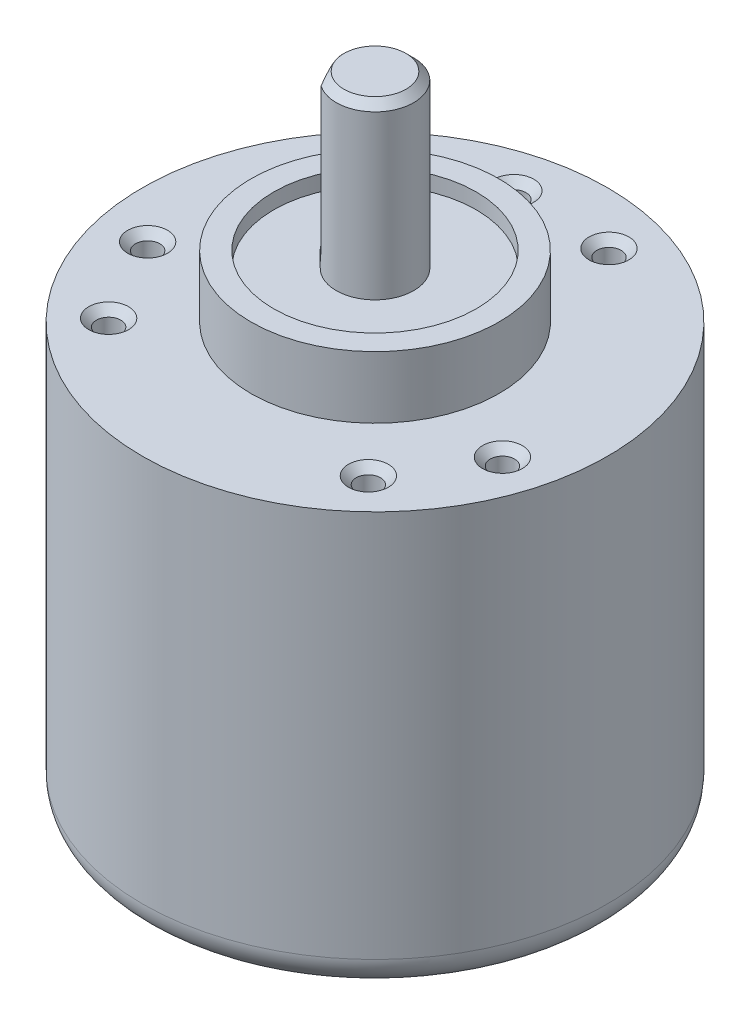
from build123d import *

# Parameters (mm, degrees)
SKETCH1_R           = 19.05
BOSS_EXTRUDE1_DEPTH = 34.29
SKETCH3_R           = 10.16
BOSS_EXTRUDE3_DEPTH = 5.08
BOSS_EXTRUDE4_DEPTH = 12.7
FILLET1_R           = 2.54
CHAMFER1_SIZE       = 0.635
SKETCH5_R           = 0.99695
CUT_EXTRUDE1_DEPTH  = 12.7
CHAMFER2_SIZE       = 0.635
CUT_EXTRUDE2_START  = -1.27
SKETCH6_R           = 8.296715315
SKETCH6_R_2         = 3.175
CUT_EXTRUDE2_DEPTH  = 1.27


with BuildPart() as part:
    # Sketch1 → Boss-Extrude1 (new body)
    with BuildSketch(Plane(origin=(0, 0, 0), x_dir=(1, 0, 0), z_dir=(0, 1, 0))):
        with Locations(Location((0, 0, 0), (0, 0, 270))):
            Circle(SKETCH1_R)
    extrude(amount=BOSS_EXTRUDE1_DEPTH)

    # Sketch3 → Boss-Extrude3 (add)
    with BuildSketch(Plane(origin=(0, 34.29, 0), x_dir=(1, 0, 0), z_dir=(0, 1, 0))):
        with Locations(Location((0, 0, 0), (0, 0, 270))):
            Circle(SKETCH3_R)
    extrude(amount=BOSS_EXTRUDE3_DEPTH)

    # Sketch4 → Boss-Extrude4 (add)
    with BuildSketch(Plane(origin=(0, 39.37, 0), x_dir=(1, 0, 0), z_dir=(0, 1, 0))):
        with BuildLine():
            Line((-3.01459652, 0.996409965), (-1.800640593, -2.615017869))
            ThreePointArc((-1.800640593, -2.615017869), (3.009523196, 1.01162994), (-3.01459652, 0.996409965))
        make_face()
    extrude(amount=BOSS_EXTRUDE4_DEPTH)

    # Fillet1
    fillet1_edges = [part.edges().sort_by_distance(p)[0] for p in [
        (0, 0, -19.05),
    ]]
    fillet(fillet1_edges, radius=FILLET1_R)

    # Chamfer1
    chamfer1_edges = [part.edges().sort_by_distance(p)[0] for p in [
        (3.009523196, 52.07, -1.01162994),
    ]]
    chamfer(chamfer1_edges, length=CHAMFER1_SIZE - 0.0001)  # a hair under: the kernel refuses the full size

    # Sketch5 → Cut-Extrude1 (cut)
    with BuildSketch(Plane(origin=(0, 34.29, 0), x_dir=(1, 0, 0), z_dir=(0, 1, 0))):
        with Locations(Location((-11.178825066, -10.636456195, 0), (0, 0, 270))):
            Circle(SKETCH5_R)
        with Locations(Location((-14.999374589, -3.622028738, 0), (0, 0, 270))):
            Circle(SKETCH5_R)
        with Locations(Location((-3.622028738, 14.999374589, 0), (0, 0, 270))):
            Circle(SKETCH5_R)
        with Locations(Location((4.362918394, 14.800853804, 0), (0, 0, 270))):
            Circle(SKETCH5_R)
        with Locations(Location((14.800853804, -4.362918394, 0), (0, 0, 270))):
            Circle(SKETCH5_R)
        with Locations(Location((10.636456195, -11.178825066, 0), (0, 0, 270))):
            Circle(SKETCH5_R)
    extrude(amount=-CUT_EXTRUDE1_DEPTH, mode=Mode.SUBTRACT)

    # Chamfer2
    chamfer2_edges = [part.edges().sort_by_distance(p)[0] for p in [
        (10.636456195, 34.29, 10.181875066),
        (14.800853804, 34.29, 3.365968394),
        (4.362918394, 34.29, -15.797803804),
        (-3.622028738, 34.29, -15.996324589),
        (-14.999374589, 34.29, 2.625078738),
        (-11.178825066, 34.29, 9.639506195),
    ]]
    chamfer(chamfer2_edges, length=CHAMFER2_SIZE)

    # Sketch6 → Cut-Extrude2 (cut)
    with BuildSketch(Plane(origin=(0, 39.37, 0), x_dir=(1, 0, 0), z_dir=(0, 1, 0)).offset(CUT_EXTRUDE2_START)):
        with Locations(Location((0, 0, 0), (0, 0, 270))):
            Circle(SKETCH6_R)
        with Locations(Location((0, 0, 0), (0, 0, 161.709808999))):
            Circle(SKETCH6_R_2, mode=Mode.SUBTRACT)
    extrude(amount=CUT_EXTRUDE2_DEPTH, mode=Mode.SUBTRACT)


solid = part.part
